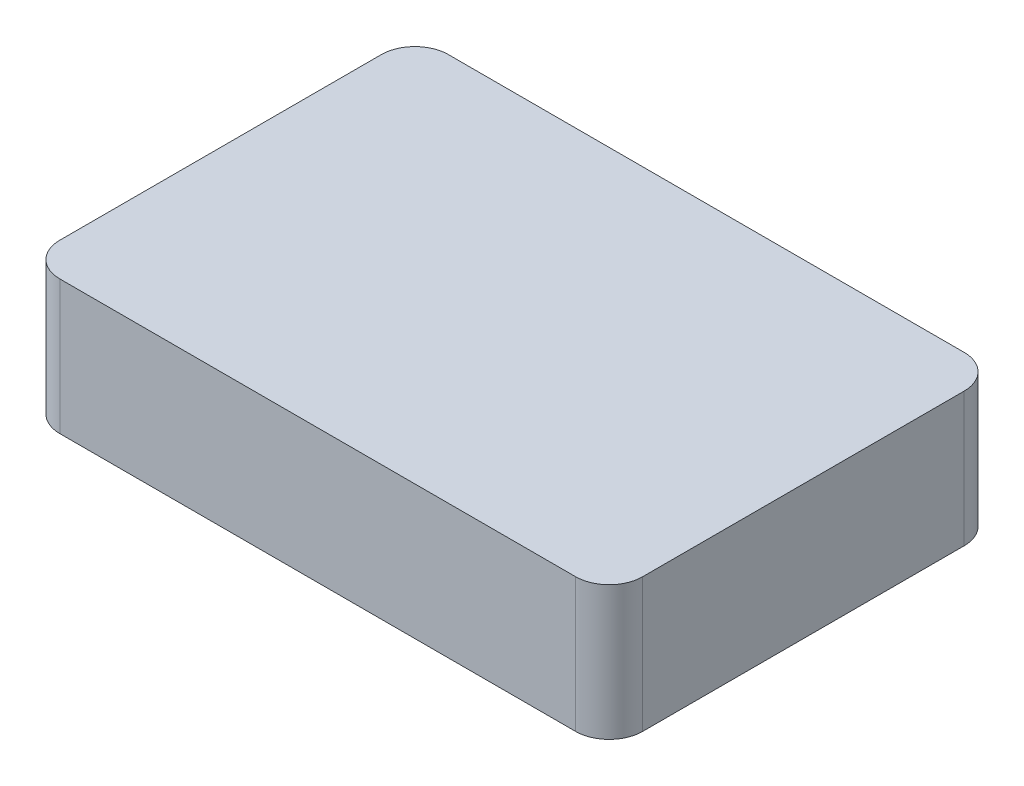
from build123d import *

# Parameters (mm, degrees)
CROQUIS1_W              = 87
CROQUIS1_H              = 58
SALIENTE_EXTRUIR1_DEPTH = 20
REDONDEO1_R             = 5


with BuildPart() as part:
    # Croquis1 → Saliente-Extruir1 (new body)
    with BuildSketch(Plane(origin=(0, 0, 0), x_dir=(1, 0, 0), z_dir=(0, 1, 0))):
        Rectangle(CROQUIS1_W, CROQUIS1_H)
    extrude(amount=SALIENTE_EXTRUIR1_DEPTH)

    # Redondeo1
    redondeo1_edges = [part.edges().sort_by_distance(p)[0] for p in [
        (-43.5, 10, -29),
        (43.5, 10, -29),
        (-43.5, 10, 29),
        (43.5, 10, 29),
    ]]
    fillet(redondeo1_edges, radius=REDONDEO1_R)


solid = part.part
